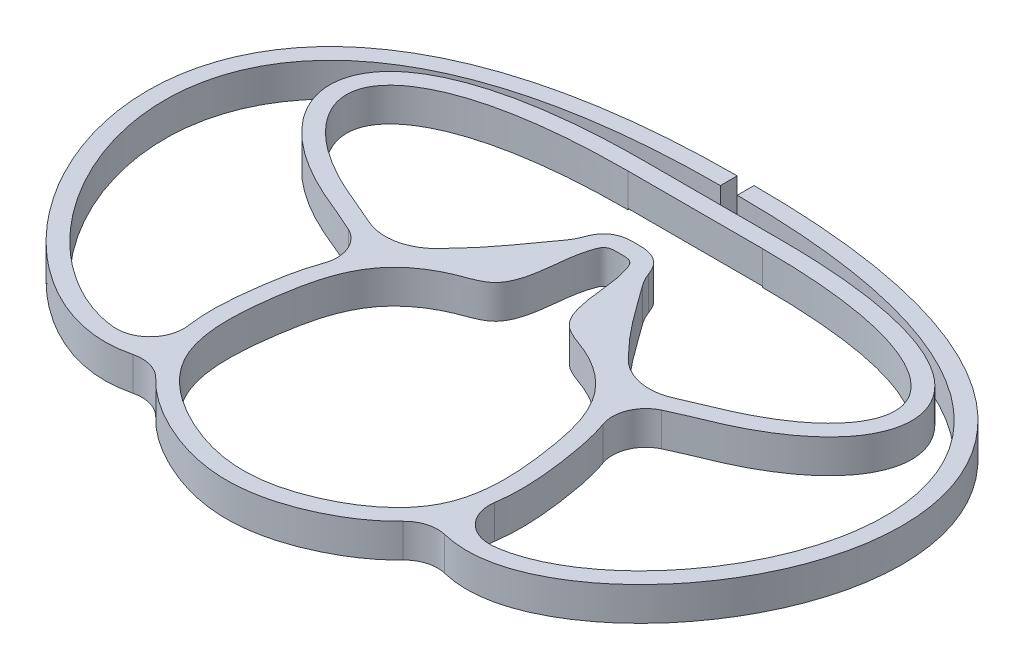
from build123d import *
from build123d.topology import SkipClean

# Parameters (mm, degrees)
BOSS_EXTRUDE1_DEPTH = 10
BOSS_EXTRUDE2_DEPTH = 10
BOSS_EXTRUDE3_REACH = 167.807
SKETCH5_W           = 5
SKETCH5_H           = 9.675639368
BOSS_EXTRUDE4_DEPTH = 10
CUT_EXTRUDE1_DEPTH  = 10
FILLET1_R           = 10
FILLET2_R           = 15
FILLET3_R           = 15


# Read off the part's stored shape, not the designer's step: Boss-Extrude1, Cut-Extrude1
with BuildPart() as part:
    # Boss-Extrude1 outline → Boss-Extrude1 (new body)
    with BuildSketch(Plane(origin=(0, 0, 0), x_dir=(1, 0, 0), z_dir=(0, 1, 0))):
        with BuildLine():
            add(Edge.make_bspline(
                [(0, 67), (-0.227277761, 67), (-0.681833283, 67.001666463), (-1.53188424, 66.987419462), (-2.512616186, 66.920390168), (-3.659808632, 66.741423554), (-4.988078912, 66.345813864), (-6.461410265, 65.591532761), (-7.855664764, 64.320134683), (-8.674867778, 63.107594724), (-9.208577304, 62.038948076), (-9.565323902, 61.116231979), (-9.81270012, 60.379002225), (-10.109494449, 59.430262188), (-10.431305892, 58.253962276), (-10.746251776, 56.878966311), (-11.001988254, 55.538552687), (-11.278954519, 53.801167078), (-11.533903834, 51.724013951), (-11.779395274, 49.374961626), (-12.037895469, 47.15146515), (-12.37325539, 45.013087546), (-12.836023726, 42.949483136), (-13.43538801, 41.198480929), (-14.003306657, 40.162683233), (-14.421319862, 39.640462503), (-14.785845689, 39.289383208), (-15.662463961, 38.701677793), (-17.417991117, 37.934908047), (-19.71677033, 37.105178592), (-22.397054658, 36.023724998), (-24.923710241, 34.773040568), (-27.361549766, 33.353237603), (-30.447251781, 31.236918919), (-33.968327967, 28.188031587), (-37.531580238, 23.840893393), (-40.196367538, 19.062950436), (-42.777966406, 12.392766722), (-44.256778564, 5.449271056), (-45.276374738, -1.416843531), (-45.88344846, -6.702537457), (-46.188923174, -12.061007753), (-46.075354509, -17.440185452), (-45.397688101, -22.789778918), (-44.007346965, -28.029159469), (-41.697102792, -33.095574637), (-38.474325789, -37.633129013), (-34.621503503, -41.580890086), (-28.836339185, -46.140112515), (-20.775488621, -50.574915101), (-10.663531249, -54.093742691), (1.1e-08, -55.453128652), (10.663531287, -54.093742702), (20.775488621, -50.574915094), (28.836339175, -46.140112511), (34.621503494, -41.580890085), (38.474325783, -37.633129015), (41.69710279, -33.09557464), (44.007346967, -28.029159472), (45.397688104, -22.78977892), (46.075354512, -17.440185452), (46.188923176, -12.061007753), (45.883448461, -6.702537456), (45.276374738, -1.416843531), (44.256778563, 5.449271057), (42.777966405, 12.392766722), (40.196367538, 19.062950436), (37.531580238, 23.840893392), (33.968327967, 28.188031587), (30.447251781, 31.236918919), (27.361549766, 33.353237603), (24.923710241, 34.773040568), (22.397054658, 36.023724998), (19.71677033, 37.105178592), (17.417991117, 37.934908047), (15.662463961, 38.701677793), (14.785845689, 39.289383208), (14.421319862, 39.640462503), (14.003306657, 40.162683233), (13.43538801, 41.198480929), (12.836023726, 42.949483136), (12.37325539, 45.013087546), (12.037895469, 47.15146515), (11.779395274, 49.374961626), (11.533903834, 51.724013951), (11.278954519, 53.801167078), (11.001988254, 55.538552687), (10.746251776, 56.878966311), (10.431305892, 58.253962276), (10.109494449, 59.430262188), (9.81270012, 60.379002225), (9.565323902, 61.116231979), (9.208577304, 62.038948076), (8.674867778, 63.107594724), (7.855664764, 64.320134683), (6.461410265, 65.591532761), (4.988078912, 66.345813864), (3.659808632, 66.741423554), (2.512616186, 66.920390168), (1.53188424, 66.987419462), (0.681833283, 67.001666463), (0.227277761, 67), (0, 67)],
                knots=[0, 0, 0, 0, 0.001953125, 0.00390625, 0.005859375, 0.0078125, 0.009765625, 0.01171875, 0.013671875, 0.015625, 0.017578125, 0.01953125, 0.021484375, 0.0234375, 0.02734375, 0.03125, 0.03515625, 0.0390625, 0.046875, 0.0546875, 0.0625, 0.0703125, 0.078125, 0.0859375, 0.09375, 0.09765625, 0.1015625, 0.109375, 0.1171875, 0.125, 0.1328125, 0.140625, 0.1484375, 0.15625, 0.171875, 0.1875, 0.203125, 0.21875, 0.25, 0.265625, 0.28125, 0.296875, 0.3125, 0.328125, 0.34375, 0.359375, 0.375, 0.390625, 0.40625, 0.4375, 0.46875, 0.5, 0.53125, 0.5625, 0.59375, 0.609375, 0.625, 0.640625, 0.65625, 0.671875, 0.6875, 0.703125, 0.71875, 0.734375, 0.75, 0.78125, 0.796875, 0.8125, 0.828125, 0.84375, 0.8515625, 0.859375, 0.8671875, 0.875, 0.8828125, 0.890625, 0.8984375, 0.90234375, 0.90625, 0.9140625, 0.921875, 0.9296875, 0.9375, 0.9453125, 0.953125, 0.9609375, 0.96484375, 0.96875, 0.97265625, 0.9765625, 0.978515625, 0.98046875, 0.982421875, 0.984375, 0.986328125, 0.98828125, 0.990234375, 0.9921875, 0.994140625, 0.99609375, 0.998046875, 1, 1, 1, 1], degree=3))
        make_face()
        with BuildLine():
            add(Edge.make_bspline(
                [(0, 62), (-1.449319465, 62), (-3.858982521, 62.04949065), (-6.738088954, 54.674450921), (-6.398410727, 46.424048099), (-10.00931101, 34.796181627), (-21.899395638, 31.626752299), (-35.797702461, 21.622188592), (-41.072037529, -2.03881706), (-42.664534833, -30.677270085), (-20.455240468, -46.503909991), (2.22e-07, -51.476412309), (20.455240774, -46.503909745), (42.664534842, -30.677270089), (41.072037527, -2.038817059), (35.797702462, 21.622188592), (21.899395638, 31.626752299), (10.00931101, 34.796181627), (6.398410727, 46.424048099), (6.738088954, 54.674450921), (3.858982521, 62.04949065), (1.449319465, 62), (0, 62)],
                knots=[0, 0, 0, 0, 0.01260166, 0.020951733, 0.070611873, 0.099127767, 0.128336455, 0.183200023, 0.259103987, 0.357412488, 0.439784745, 0.500000002, 0.560215255, 0.642587512, 0.740896013, 0.816799977, 0.871663545, 0.900872233, 0.929388127, 0.979048267, 0.98739834, 1, 1, 1, 1], degree=3))
        make_face(mode=Mode.SUBTRACT)
    extrude(amount=BOSS_EXTRUDE1_DEPTH)

    # Sketch4 → Boss-Extrude2 (add)
    with SkipClean():  # the faces are left unmerged after this step: merging them gives an invalid solid
        with BuildSketch(Plane(origin=(0, 0, 0), x_dir=(1, 0, 0), z_dir=(0, 1, 0))):
            with BuildLine():
                Line((36.001435144, 21.510151116), (32.989848884, 25.501435144))
                add(Edge.make_bspline(
                    [(32.989848884, 25.501435144), (33.425904934, 25.830457183), (34.313968658, 26.48080105), (36.072566231, 27.69504105), (38.270592978, 29.086203691), (40.884090161, 30.570145901), (44.32483354, 32.339701692), (48.510905622, 34.224389884), (53.268382553, 36.177393867), (57.652910752, 38.01872613), (63.005268193, 40.61727191), (68.877632841, 44.138456306), (74.470046741, 48.637299657), (78.525541798, 53.243801305), (80.978116507, 57.760211542), (81.855665722, 61.99417376), (81.275800506, 65.944379078), (79.124242663, 69.836913596), (75.044455428, 73.670494462), (68.80751616, 77.216901212), (61.72207217, 79.749891161), (54.882040457, 81.434382574), (49.156834898, 82.507729523), (42.826766933, 83.3726613), (37.039626164, 83.905270377), (32.097141943, 84.210054319), (28.233698767, 84.375938212), (24.878836033, 84.460222414), (22.121536398, 84.494269899), (20.703938936, 84.5), (20, 84.5)],
                    knots=[0, 0, 0, 0, 0.0078125, 0.015625, 0.03125, 0.046875, 0.0625, 0.09375, 0.125, 0.15625, 0.1875, 0.25, 0.3125, 0.375, 0.4375, 0.5, 0.5625, 0.625, 0.6875, 0.75, 0.8125, 0.84375, 0.875, 0.90625, 0.9375, 0.953125, 0.96875, 0.984375, 0.9921875, 1, 1, 1, 1], degree=3))
                Line((20, 84.5), (20, 89.5))
                add(Edge.make_bspline(
                    [(36.001435144, 21.510151116), (36.791355068, 22.106177851), (38.426458286, 23.267817999), (41.644072643, 25.30300336), (45.678687235, 27.464474409), (50.46211324, 29.619865664), (55.144849384, 31.542973878), (59.69406589, 33.451893779), (65.40203988, 36.221206147), (71.70537263, 39.997512732), (77.892695496, 44.960196956), (82.596597458, 50.273966881), (85.693220501, 55.893474329), (86.964976339, 61.767255495), (86.104516012, 67.652992445), (83.036391591, 73.080920392), (77.927411095, 77.808657398), (70.816767128, 81.820755415), (63.155443622, 84.547785587), (55.928916419, 86.326236069), (49.945944299, 87.447099978), (43.38573774, 88.342925029), (37.426521575, 88.891019564), (32.356528233, 89.203613031), (28.402137535, 89.373362145), (24.975191752, 89.459432653), (22.16209401, 89.494161604), (20.717536504, 89.5), (20, 89.5)],
                    knots=[0, 0, 0, 0, 0.015625, 0.03125, 0.0625, 0.09375, 0.125, 0.15625, 0.1875, 0.25, 0.3125, 0.375, 0.4375, 0.5, 0.5625, 0.625, 0.6875, 0.75, 0.8125, 0.84375, 0.875, 0.90625, 0.9375, 0.953125, 0.96875, 0.984375, 0.9921875, 1, 1, 1, 1], degree=3))
            make_face()
            with BuildLine():
                Line((38.495197904, -33.392577358), (40.892577358, -29.004802096))
                add(Edge.make_bspline(
                    [(40.892577358, -29.004802096), (41.313897661, -29.235001816), (42.175654297, -29.680146818), (43.871942544, -30.455910902), (45.989538301, -31.242988496), (48.514457543, -31.905305036), (51.87060356, -32.436663009), (56.057395298, -32.476036357), (62.769017092, -31.325412337), (71.203537649, -27.799249461), (80.994568389, -20.919048897), (89.910106167, -11.834458231), (100.010550581, 2.553950255), (106.500393277, 19.344031774), (107.697418576, 36.494252476), (105.576497738, 49.060937854), (100.050274839, 60.927985706), (90.64547944, 71.745212254), (79.107770111, 79.538330788), (67.389291044, 84.782156602), (57.296510643, 88.151180681), (45.841912229, 90.88869943), (35.11611257, 92.587888866), (25.799303049, 93.565160747), (18.43964817, 94.098987607), (11.981890391, 94.371205507), (6.638119918, 94.481412567), (3.871510764, 94.5), (2.5, 94.5)],
                    knots=[0, 0, 0, 0, 0.0078125, 0.015625, 0.03125, 0.046875, 0.0625, 0.09375, 0.125, 0.1875, 0.25, 0.3125, 0.375, 0.5, 0.5625, 0.625, 0.6875, 0.75, 0.8125, 0.84375, 0.875, 0.90625, 0.9375, 0.953125, 0.96875, 0.984375, 0.9921875, 1, 1, 1, 1], degree=3))
                Line((2.5, 94.5), (2.5, 99.5))
                add(Edge.make_bspline(
                    [(38.495197904, -33.392577358), (38.985110114, -33.660254119), (39.984652117, -34.176598704), (41.972337036, -35.085949158), (44.474470673, -36.016580186), (47.48351619, -36.806400111), (51.495588788, -37.441690788), (56.4818711, -37.48604512), (64.308091379, -36.132597179), (73.696672097, -32.175416232), (84.273772666, -24.728623425), (93.779840474, -15.035379356), (101.814604993, -3.586517135), (107.954137862, 9.15882411), (111.753439573, 22.742600404), (112.740652319, 36.704196748), (110.41513095, 50.551435142), (104.282462171, 63.718515022), (93.937056463, 75.586491895), (81.540654491, 83.932591996), (69.186810123, 89.456474303), (58.65298672, 92.970247731), (46.798408283, 95.801393277), (35.773754074, 97.546688263), (26.237468978, 98.546787556), (18.722526746, 99.091737178), (12.142942157, 99.369003331), (6.705594353, 99.481113845), (3.894166968, 99.5), (2.5, 99.5)],
                    knots=[0, 0, 0, 0, 0.0078125, 0.015625, 0.03125, 0.046875, 0.0625, 0.09375, 0.125, 0.1875, 0.25, 0.3125, 0.375, 0.4375, 0.5, 0.5625, 0.625, 0.6875, 0.75, 0.8125, 0.84375, 0.875, 0.90625, 0.9375, 0.953125, 0.96875, 0.984375, 0.9921875, 1, 1, 1, 1], degree=3))
            make_face()
        boss_extrude2 = extrude(amount=BOSS_EXTRUDE2_DEPTH)
    add(part.part.scale(1), mode=Mode.REPLACE)  # the faces are merged on a copy

    # Mirror1: Boss-Extrude2 across plane
    add(boss_extrude2.mirror(Plane(origin=(0, 0, 0), x_dir=(0, 0, 1), z_dir=(1, 0, 0))))

    # Sketch5 → Boss-Extrude3 (add, up to next)
    with BuildSketch(Plane(origin=(-20, 0, 0), x_dir=(0, 0, -1), z_dir=(1, 0, 0)), mode=Mode.PRIVATE) as boss_extrude3_sk1:
        with Locations((87, 5.162180316)):
            Rectangle(SKETCH5_W, SKETCH5_H)
    boss_extrude3_tool1 = extrude(boss_extrude3_sk1.sketch, amount=BOSS_EXTRUDE3_REACH, mode=Mode.PRIVATE) - part.part
    add(boss_extrude3_tool1.solids().sort_by_distance((-20, 5.16218, -87))[0])

    # Sketch6 → Boss-Extrude4 (add)
    with BuildSketch(Plane(origin=(0, 0, 0), x_dir=(1, 0, 0), z_dir=(0, 1, 0))):
        with BuildLine():
            add(Edge.make_bspline(
                [(-37.947275581, 22.910726234), (-37.790468451, 27.751065723), (-18.476175905, 43.10060367), (0, 80.958186429), (18.476175905, 43.10060367), (62.968907564, 7.741147903), (-38.438707648, 7.741147903), (-37.947275581, 22.910726234)],
                knots=[0, 0, 0, 0, 0.125910697, 0.302698532, 0.479486367, 0.605397064, 1, 1, 1, 1], degree=3))
        make_face()
    extrude(amount=BOSS_EXTRUDE4_DEPTH)

    # Cut-Extrude1 outline → Cut-Extrude1 (cut)
    with BuildSketch(Plane(origin=(0, 0, 0), x_dir=(1, 0, 0), z_dir=(0, 1, 0))):
        with BuildLine():
            add(Edge.make_bspline(
                [(34.977941029, 18.053522696), (34.257980413, 19.436214451), (30.560370679, 25.39223196), (21.899395638, 31.626752299), (10.00931101, 34.796181627), (6.398410727, 46.424048099), (6.738088954, 54.674450921), (3.858982521, 62.04949065), (0, 61.970233282), (-3.858982521, 62.04949065), (-6.738088954, 54.674450921), (-6.398410727, 46.424048099), (-10.00931101, 34.796181627), (-21.899395638, 31.626752299), (-30.560370679, 25.39223196), (-34.257980413, 19.436214451), (-34.97794103, 18.053522696)],
                knots=[0.80118023, 0.80118023, 0.80118023, 0.80118023, 0.816799977, 0.871663545, 0.900872233, 0.929388127, 0.979048267, 0.98739834, 1, 1.01260166, 1.020951733, 1.070611873, 1.099127767, 1.128336455, 1.183200023, 1.19881977, 1.19881977, 1.19881977, 1.19881977], degree=3))
            add(Edge.make_bspline(
                [(-34.97794103, 18.053522696), (-22.847562853, 9.360215749), (22.847562851, 9.360215749), (34.977941029, 18.053522696)],
                knots=[0.047940861, 0.047940861, 0.047940861, 0.047940861, 0.346662075, 0.346662075, 0.346662075, 0.346662075], degree=3))
        make_face()
    extrude(amount=CUT_EXTRUDE1_DEPTH, mode=Mode.SUBTRACT)

    # Fillet1
    fillet1_edges = [part.edges().sort_by_distance(p)[0] for p in [
        (-37.947275581, 5, -22.910726234),
        (-43.030289009, 5, 30.066878944),
        (-40.642659002, 5, 34.473831224),
        (40.642659, 5, 34.473831223),
        (43.03028901, 5, 30.066878945),
        (37.947275581, 5, -22.910726234),
    ]]
    fillet(fillet1_edges, radius=FILLET1_R)

    # Fillet2
    fillet2_edges = [part.edges().sort_by_distance(p)[0] for p in [
        (-35.976848858, 5, -27.612214406),
        (35.976848858, 5, -27.612214406),
    ]]
    fillet(fillet2_edges, radius=FILLET2_R)

    # Fillet3
    fillet3_edges = [part.edges().sort_by_distance(p)[0] for p in [
        (10.200073928, 5, -59.08729167),
        (-10.200073928, 5, -59.08729167),
    ]]
    fillet(fillet3_edges, radius=FILLET3_R)


solid = part.part
